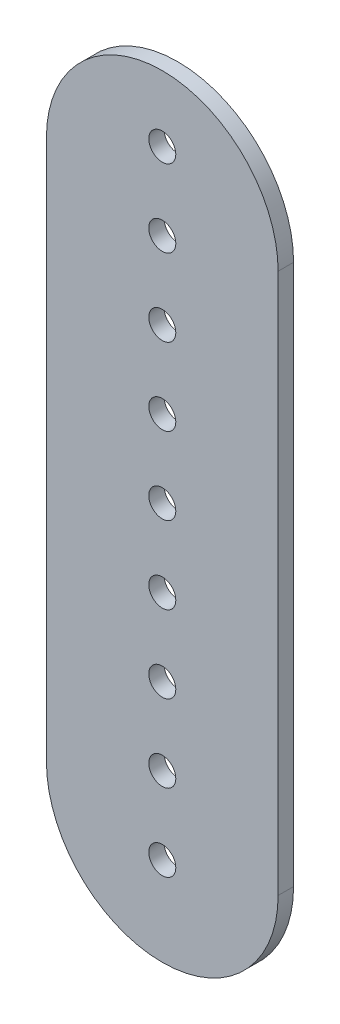
from build123d import *

# Parameters (mm, degrees)
BOSS_EXTRUDE1_DEPTH = 2
SKETCH2_R           = 1.75
CUT_EXTRUDE1_DEPTH  = 87.336550777
LPATTERN1_COUNT     = 9
LPATTERN1_PITCH     = 10


with BuildPart() as part:
    # Sketch1 → Boss-Extrude1 (new body)
    with BuildSketch(Plane.XY):
        with BuildLine():
            Line((-15, 0), (-15, 70))
            ThreePointArc((-15, 70), (0, 85), (15, 70))
            Line((15, 70), (15, 0))
            ThreePointArc((15, 0), (0, -15), (-15, 0))
        make_face()
    extrude(amount=BOSS_EXTRUDE1_DEPTH)

    # Sketch2 → Cut-Extrude1 (cut, through all)
    with BuildSketch(Plane.XY.offset(2)):
        with Locations((0, -3.523112296)):
            Circle(SKETCH2_R)
    cut_extrude1 = extrude(amount=-CUT_EXTRUDE1_DEPTH, mode=Mode.SUBTRACT)

    # LPattern1: Cut-Extrude1 ×9
    with Locations(*[(0, i * LPATTERN1_PITCH, 0) for i in range(1, LPATTERN1_COUNT)]):
        add(cut_extrude1, mode=Mode.SUBTRACT)


solid = part.part
